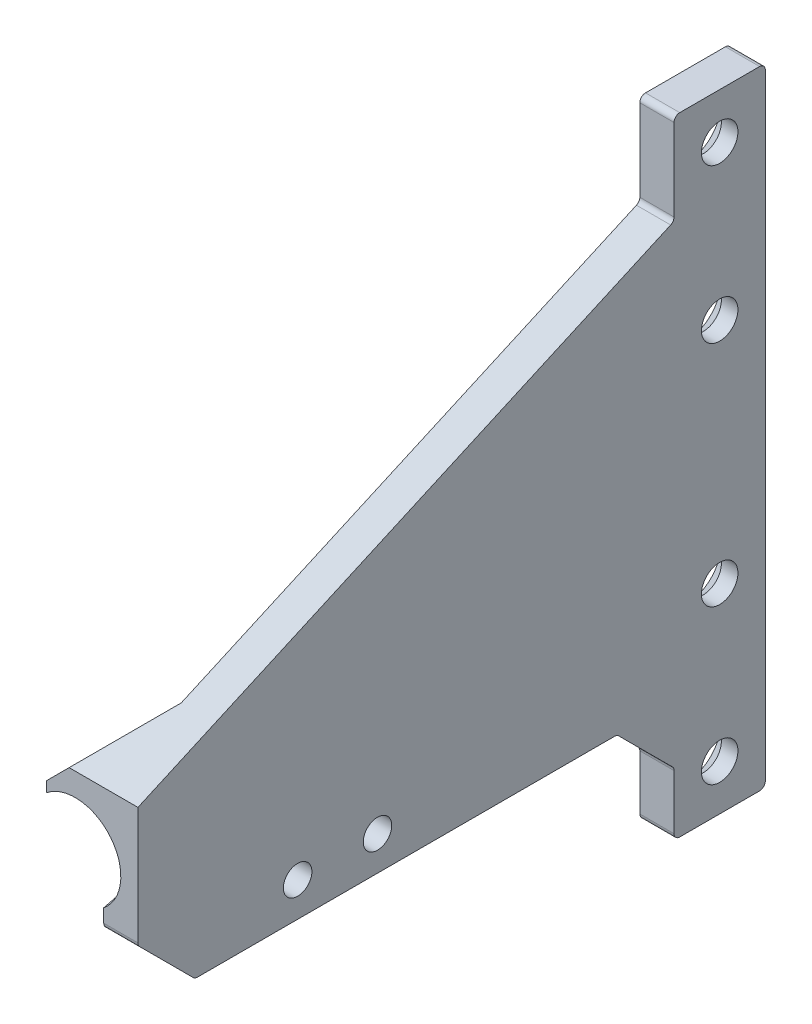
from build123d import *

# Parameters (mm, degrees)
BOSS_EXTRUDE1_DEPTH                            = 55
SKETCH6_W                                      = 47
SKETCH6_H                                      = 10.5
CUT_EXTRUDE3_DEPTH                             = 55
CHAMFER3_SIZE                                  = 5
CHAMFER4_SIZE                                  = 5
CSK_FOR_M3_FLAT_HEAD_MACHINE_SCREW1_AT_2_COUNT = 2
CSK_FOR_M3_FLAT_HEAD_MACHINE_SCREW1_AT_2_PITCH = 13.5
CSK_FOR_M3_FLAT_HEAD_MACHINE_SCREW1_AT_3_COUNT = 2
CSK_FOR_M3_FLAT_HEAD_MACHINE_SCREW1_AT_3_PITCH = 47
CSK_FOR_M3_FLAT_HEAD_MACHINE_SCREW1_AT_4_COUNT = 2
CSK_FOR_M3_FLAT_HEAD_MACHINE_SCREW1_AT_4_PITCH = 33.5
TAP_DRILL_FOR_M3X0_5_TAP1_D                    = 2.5
FILLET1_R                                      = 0.5


# Read off the part's stored shape, not the designer's step: Body-Delete/Keep 1
with BuildPart() as part:
    # Sketch1 → Boss-Extrude1 (new body)
    with BuildSketch(Plane.XY):
        Polygon((22, -20), (25, -20), (25, 1.035533906), (27.5, 3.535533906), (30, 1.035533906), (30, 9.035533906), (25, 9.035533906), (25, 35), (22, 35), align=None)
    extrude(amount=BOSS_EXTRUDE1_DEPTH)

    # Sketch4 → Cut-Revolve1 (revolve, cut)
    with BuildSketch(Plane(origin=(0, 0, 0), x_dir=(1, 0, 0), z_dir=(0, 1, 0))):
        Polygon((27.5, -47.011533546), (30, -47.011533546), (31.5, -55.011533546), (27.5, -55.011533546), align=None)
    revolve(axis=Axis((27.5, 0, 0), (0, 0, 1)), mode=Mode.SUBTRACT)

    # Sketch6 → Cut-Extrude3 (cut)
    with BuildSketch(Plane.ZY.offset(-22)):
        Polygon((55, 6), (55, 35), (8, 35), (8, 27), align=None)
        with Locations((31.5, -14.75)):
            Rectangle(SKETCH6_W, SKETCH6_H)
    extrude(amount=-CUT_EXTRUDE3_DEPTH, mode=Mode.SUBTRACT)

    # Chamfer3
    chamfer3_edges = [part.edges().sort_by_distance(p)[0] for p in [
        (23.5, -9.5, 55),
        (23.5, -9.5, 8),
    ]]
    chamfer(chamfer3_edges, length=CHAMFER3_SIZE)

    # Chamfer4
    chamfer4_edges = [part.edges().sort_by_distance(p)[0] for p in [
        (30, 9.035533906, 24.10309301),
    ]]
    chamfer(chamfer4_edges, length=CHAMFER4_SIZE - 0.0001)  # a hair under: the kernel refuses the full size

    # Sketch8 → CSK for M3 Flat Head Machine Screw1 (revolve, cut)
    with BuildSketch(Plane(origin=(25, 31, 4), x_dir=(0, 0, -1), z_dir=(0, 1, 0))):
        Polygon((0, 0), (0, 3), (1.6, 3), (1.6, 1.55), (3.15, 0), align=None)
    csk_for_m3_flat_head_machine_screw1 = revolve(axis=Axis((31.35, 31, 4), (-1, 0, 0)), mode=Mode.SUBTRACT)

    # CSK for M3 Flat Head Machine Screw1 at 2: CSK for M3 Flat Head Machine Screw1 ×2
    with Locations(*[(0, -i * CSK_FOR_M3_FLAT_HEAD_MACHINE_SCREW1_AT_2_PITCH, 0) for i in range(1, CSK_FOR_M3_FLAT_HEAD_MACHINE_SCREW1_AT_2_COUNT)]):
        add(csk_for_m3_flat_head_machine_screw1, mode=Mode.SUBTRACT)

    # CSK for M3 Flat Head Machine Screw1 at 3: CSK for M3 Flat Head Machine Screw1 ×2
    with Locations(*[(0, -i * CSK_FOR_M3_FLAT_HEAD_MACHINE_SCREW1_AT_3_PITCH, 0) for i in range(1, CSK_FOR_M3_FLAT_HEAD_MACHINE_SCREW1_AT_3_COUNT)]):
        add(csk_for_m3_flat_head_machine_screw1, mode=Mode.SUBTRACT)

    # CSK for M3 Flat Head Machine Screw1 at 4: CSK for M3 Flat Head Machine Screw1 ×2
    with Locations(*[(0, -i * CSK_FOR_M3_FLAT_HEAD_MACHINE_SCREW1_AT_4_PITCH, 0) for i in range(1, CSK_FOR_M3_FLAT_HEAD_MACHINE_SCREW1_AT_4_COUNT)]):
        add(csk_for_m3_flat_head_machine_screw1, mode=Mode.SUBTRACT)

    # Tap Drill for M3x0.5 Tap1 (through all)
    with Locations(Plane(origin=(25, 0, 0), x_dir=(0, 0, -1), z_dir=(1, 0, 0))):
        with Locations((-41, -6.5), (-34, -6.5)):
            Hole(TAP_DRILL_FOR_M3X0_5_TAP1_D / 2)

    # Fillet1
    fillet1_edges = [part.edges().sort_by_distance(p)[0] for p in [
        (23.5, -20, 0),
        (23.5, 27, 8),
        (23.5, 35, 8),
        (23.5, -20, 8),
        (23.5, -14.5, 8),
        (23.5, -9.5, 50),
        (23.5, -9.5, 13),
        (23.5, -4.5, 55),
        (23.5, 35, 0),
    ]]
    fillet(fillet1_edges, radius=FILLET1_R)


with BuildPart() as body_2:
    # Mirror2: mirrored copy
    add(part.part.mirror(Plane(origin=(22, -20, 55), x_dir=(0, 0, 1), z_dir=(1, 0, 0))))


solid = body_2.part
